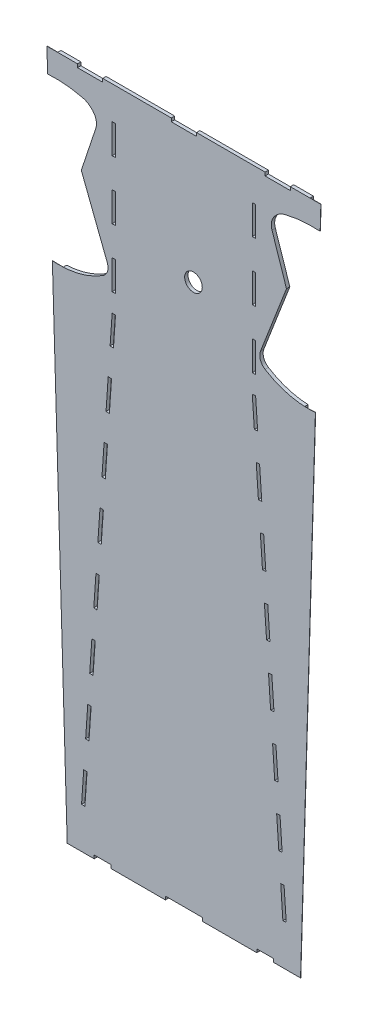
from build123d import *

# Parameters (mm, degrees)
SKETCH1_W           = 10.166490401
SKETCH1_H           = 88.9
BOSS_EXTRUDE1_DEPTH = 10.16
CUT_LOFT1_DEPTH     = 9.5
CUT_EXTRUDE1_DEPTH  = 25.4
SKETCH6_R           = 26.581471798
CUT_EXTRUDE2_DEPTH  = 12


# Read off the part's stored shape, not the designer's step: Cut-Loft1
with BuildPart() as part:
    # Sketch1 → Boss-Extrude1 (new body)
    with BuildSketch(Plane.XY):
        Polygon((-245, 2053.071580455), (-245, 2042.911580455), (-321.2, 2042.911580455), (-321.2, 2053.071580455), (-413.472915973, 2053.071580455), (-352.180527886, 0), (-270.8, 0), (-270.8, 10.16), (-220, 10.16), (-220, 0), (-55.8292, 0), (-55.8292, 10.16), (55.8292, 10.16), (55.8292, 0), (220, 0), (220, 10.16), (270.8, 10.16), (270.8, 0), (352.180527886, 0), (413.472915973, 2053.071580455), (321.2, 2053.071580455), (321.2, 2042.911580455), (245, 2042.911580455), (245, 2053.071580455), (38.1, 2053.071580455), (38.1, 2042.911580455), (-38.1, 2042.911580455), (-38.1, 2053.071580455), align=None)
        with Locations((-211.45202358, 1909.561580455)):
            Rectangle(SKETCH1_W, SKETCH1_H, mode=Mode.SUBTRACT)
        with Locations((-211.45202358, 1731.761580455)):
            Rectangle(SKETCH1_W, SKETCH1_H, mode=Mode.SUBTRACT)
        Polygon((-298.801924037, 122.832814726), (-292.291252627, 216.569681682), (-302.408932711, 217.272424291), (-308.919604121, 123.535557335), align=None, mode=Mode.SUBTRACT)
        Polygon((-286.484012658, 300.178951146), (-279.971498388, 393.942350533), (-290.089178472, 394.645093142), (-296.601692742, 300.881693756), align=None, mode=Mode.SUBTRACT)
        Polygon((-274.16610128, 477.525087567), (-267.651744149, 571.315019385), (-277.769424233, 572.017761994), (-284.283781364, 478.227830176), align=None, mode=Mode.SUBTRACT)
        Polygon((-261.848189901, 654.871223988), (-255.33198991, 748.687688236), (-265.449669994, 749.390430845), (-271.965869985, 655.573966597), align=None, mode=Mode.SUBTRACT)
        Polygon((-249.530278522, 832.217360408), (-243.012235672, 926.060357088), (-253.129915756, 926.763099697), (-259.647958606, 832.920103017), align=None, mode=Mode.SUBTRACT)
        Polygon((-237.212367144, 1009.563496829), (-230.692481433, 1103.433025939), (-240.810161517, 1104.135768548), (-247.330047228, 1010.266239438), align=None, mode=Mode.SUBTRACT)
        Polygon((-224.894455765, 1186.909633249), (-218.372727194, 1280.805694791), (-228.490407278, 1281.5084374), (-235.012135849, 1187.612375858), align=None, mode=Mode.SUBTRACT)
        Polygon((-206.36877838, 1453.631580489), (-216.535268781, 1453.631580489), (-222.69422447, 1364.958512279), (-212.576544386, 1364.25576967), align=None, mode=Mode.SUBTRACT)
        Polygon((216.535268781, 1453.631580489), (206.36877838, 1453.631580489), (212.576544386, 1364.25576967), (222.69422447, 1364.958512279), align=None, mode=Mode.SUBTRACT)
        Polygon((218.372727194, 1280.805694791), (224.894455765, 1186.909633249), (235.012135849, 1187.612375858), (228.490407278, 1281.5084374), align=None, mode=Mode.SUBTRACT)
        Polygon((230.692481433, 1103.433025939), (237.212367144, 1009.563496829), (247.330047228, 1010.266239438), (240.810161517, 1104.135768548), align=None, mode=Mode.SUBTRACT)
        Polygon((243.012235672, 926.060357088), (249.530278522, 832.217360408), (259.647958606, 832.920103017), (253.129915756, 926.763099697), align=None, mode=Mode.SUBTRACT)
        Polygon((255.33198991, 748.687688236), (261.848189901, 654.871223988), (271.965869985, 655.573966597), (265.449669994, 749.390430845), align=None, mode=Mode.SUBTRACT)
        Polygon((267.651744149, 571.315019385), (274.16610128, 477.525087567), (284.283781364, 478.227830176), (277.769424233, 572.017761994), align=None, mode=Mode.SUBTRACT)
        Polygon((279.971498388, 393.942350533), (286.484012658, 300.178951146), (296.601692742, 300.881693756), (290.089178472, 394.645093142), align=None, mode=Mode.SUBTRACT)
        Polygon((292.291252627, 216.569681682), (298.801924037, 122.832814726), (308.919604121, 123.535557335), (302.408932711, 217.272424291), align=None, mode=Mode.SUBTRACT)
        with Locations((211.45202358, 1731.761580455)):
            Rectangle(SKETCH1_W, SKETCH1_H, mode=Mode.SUBTRACT)
        with Locations((-211.45202358, 1553.961580455)):
            Rectangle(SKETCH1_W, SKETCH1_H, mode=Mode.SUBTRACT)
        with Locations((211.45202358, 1553.961580455)):
            Rectangle(SKETCH1_W, SKETCH1_H, mode=Mode.SUBTRACT)
        with Locations((211.45202358, 1909.561580455)):
            Rectangle(SKETCH1_W, SKETCH1_H, mode=Mode.SUBTRACT)
    extrude(amount=BOSS_EXTRUDE1_DEPTH)

    # Cut-Loft1 outline → Cut-Loft1 (cut)
    with BuildSketch(Plane.XY):
        Polygon((413.472915973, 2053.071580455), (380.911770747, 2053.071580455), (319.430777619, 0), (352.180527886, 0), align=None)
    cut_loft1 = extrude(amount=CUT_LOFT1_DEPTH, mode=Mode.SUBTRACT)

    # Mirror1: Cut-Loft1 across plane
    add(cut_loft1.mirror(Plane(origin=(0, 0, 0), x_dir=(0, 0, 1), z_dir=(1, 0, 0))), mode=Mode.SUBTRACT)

    # Sketch5 → Cut-Extrude1 (cut)
    with BuildSketch(Plane(origin=(0, -2053.071580455, 0), x_dir=(-1, 0, 0), z_dir=(0, 0, -1))):
        with BuildLine():
            Line((265.952588541, 3964.874358992), (309.664998773, 3833.467362798))
            Line((309.664998773, 3833.467362798), (231.297825955, 3631.511391575))
            ThreePointArc((231.297825955, 3631.511391575), (230.724010197, 3608.640442733), (244.842202975, 3590.6380485))
            ThreePointArc((244.842202975, 3590.6380485), (308.245951106, 3562.321447149), (377.018264457, 3552.717588262))
            ThreePointArc((377.018264457, 3552.717588262), (435.60976827, 3559.672295818), (491.022106504, 3579.94062204))
            ThreePointArc((491.022106504, 3579.94062204), (491.585215906, 3580.230121378), (492.143646285, 3580.52854654))
            ThreePointArc((492.143646285, 3580.52854654), (497.045740968, 3584.75880587), (499.759073304, 3590.637875006))
            ThreePointArc((499.759073304, 3590.637875006), (501.002060754, 3603.106549758), (499.250120406, 3615.513949682))
            Line((499.250120406, 3615.513949682), (444.869952003, 3819.859165226))
            Line((444.869952003, 3819.859165226), (440.006038151, 3832.61308719))
            Line((440.006038151, 3832.61308719), (487.226155437, 3950.300171727))
            ThreePointArc((487.226155437, 3950.300171727), (493.113582775, 3971.655611816), (494.085205077, 3993.786417769))
            ThreePointArc((494.085205077, 3993.786417769), (490.90037063, 4005.087117499), (483.4565367, 4014.166672624))
            ThreePointArc((483.4565367, 4014.166672624), (464.015066469, 4025.682823693), (442.111254245, 4031.233995667))
            ThreePointArc((442.111254245, 4031.233995667), (373.738136291, 4034.908104808), (305.933283146, 4025.374782895))
            ThreePointArc((305.933283146, 4025.374782895), (286.026753768, 4016.410319327), (270.763848637, 4000.800218563))
            ThreePointArc((270.763848637, 4000.800218563), (264.206620212, 3983.393278803), (265.952588541, 3964.874358992))
        make_face()
        with BuildLine():
            Line((-487.226155437, 3950.300171727), (-440.006038151, 3832.61308719))
            Line((-440.006038151, 3832.61308719), (-444.869952003, 3819.859165226))
            Line((-444.869952003, 3819.859165226), (-499.250120406, 3615.513949682))
            ThreePointArc((-499.250120406, 3615.513949682), (-501.002060754, 3603.106549758), (-499.759073304, 3590.637875006))
            ThreePointArc((-499.759073304, 3590.637875006), (-497.045740968, 3584.75880587), (-492.143646285, 3580.52854654))
            ThreePointArc((-492.143646285, 3580.52854654), (-491.585215906, 3580.230121378), (-491.022106504, 3579.94062204))
            ThreePointArc((-491.022106504, 3579.94062204), (-435.60976827, 3559.672295818), (-377.018264457, 3552.717588262))
            ThreePointArc((-377.018264457, 3552.717588262), (-308.245951106, 3562.321447149), (-244.842202975, 3590.6380485))
            ThreePointArc((-244.842202975, 3590.6380485), (-230.724010197, 3608.640442733), (-231.297825955, 3631.511391575))
            Line((-231.297825955, 3631.511391575), (-309.664998773, 3833.467362798))
            Line((-309.664998773, 3833.467362798), (-265.952588541, 3964.874358992))
            ThreePointArc((-265.952588541, 3964.874358992), (-264.206620212, 3983.393278803), (-270.763848637, 4000.800218563))
            ThreePointArc((-270.763848637, 4000.800218563), (-286.026753768, 4016.410319327), (-305.933283146, 4025.374782895))
            ThreePointArc((-305.933283146, 4025.374782895), (-373.738136291, 4034.908104808), (-442.111254245, 4031.233995667))
            ThreePointArc((-442.111254245, 4031.233995667), (-464.015066469, 4025.682823693), (-483.4565367, 4014.166672624))
            ThreePointArc((-483.4565367, 4014.166672624), (-490.90037063, 4005.087117499), (-494.085205077, 3993.786417769))
            ThreePointArc((-494.085205077, 3993.786417769), (-493.113582775, 3971.655611816), (-487.226155437, 3950.300171727))
        make_face()
    extrude(amount=-CUT_EXTRUDE1_DEPTH, mode=Mode.SUBTRACT)

    # Sketch6 → Cut-Extrude2 (cut)
    with BuildSketch(Plane.XY.offset(10.16)):
        with Locations((28.844157405, 1657.225539641)):
            Circle(SKETCH6_R)
    extrude(amount=-CUT_EXTRUDE2_DEPTH, mode=Mode.SUBTRACT)


solid = part.part
